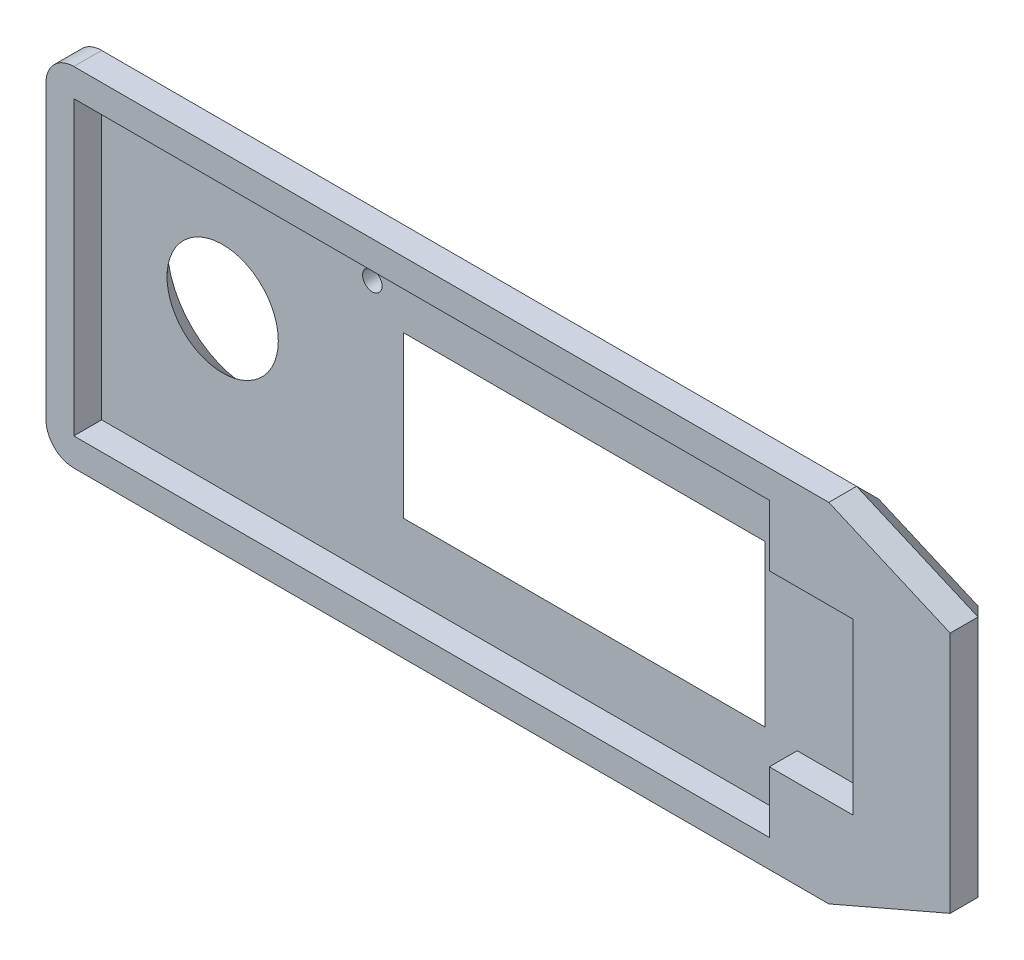
from build123d import *

# Parameters (mm, degrees)
EXTRUDE_1_DEPTH     = 2
EXTRUDE_2_DEPTH     = 2
SKETCH_4_R          = 4
SKETCH_4_R_2        = 0.7
SKETCH_4_W          = 26
SKETCH_4_H          = 11.55
CUT_EXTRUDE_1_DEPTH = 49.322997027
CHAMFER_3_SIZE      = 2
FILLET_2_R          = 2
CHAMFER_4_SIZE      = 2


# Some blends are built 0.0001 mm under size
with BuildPart() as part:
    # Эскиз1 → Бобышка-Вытянуть1 (new body)
    with BuildSketch(Plane.XY):
        Polygon((46.296875, 9.92578125), (37.5703125, 13.70078125), (-18.703125, 13.70078125), (-18.703125, -11.29921875), (37.5703125, -11.29921875), (46.296875, -7.52421875), align=None)
    extrude(amount=EXTRUDE_1_DEPTH)

    # Эскиз2 → Бобышка-Вытянуть2 (add)
    with BuildSketch(Plane.XY.offset(2)):
        Polygon((-18.703125, -11.29921875), (37.5703125, -11.29921875), (46.296875, -7.52421875), (46.296875, 9.92578125), (37.5703125, 13.70078125), (-18.703125, 13.70078125), align=None)
        Polygon((-16.703125, 11.70078125), (33.296875, 11.70078125), (33.296875, 7.30078125), (39.296875, 7.30078125), (39.296875, -4.89921875), (33.296875, -4.89921875), (33.296875, -9.29921875), (-16.703125, -9.29921875), align=None, mode=Mode.SUBTRACT)
    extrude(amount=EXTRUDE_2_DEPTH)

    # Эскиз4 → Вырез-Вытянуть1 (cut, through all)
    with BuildSketch(Plane.XY.offset(2)):
        with Locations((-8.003125, 1.96785345)):
            Circle(SKETCH_4_R)
        with Locations((2.756875, 9.10078125)):
            Circle(SKETCH_4_R_2)
        with Locations((17.996875, 1.20078125)):
            Rectangle(SKETCH_4_W, SKETCH_4_H)
    extrude(amount=-CUT_EXTRUDE_1_DEPTH, mode=Mode.SUBTRACT)

    # Фаска3
    # the kernel refuses this chamfer: 2 mm, written as the material it takes off along each edge
    with BuildSketch(Plane(origin=(51.017483297, 7.883706112, 0), x_dir=(0.010916712185249174, 0.025235859914990173, 0.9996219169112968), z_dir=(-0.9178052503070296, 0.3970308835705994, 0))) as chamfer_3_piece_1:
        Polygon((CHAMFER_3_SIZE * 0.999621916911, -CHAMFER_3_SIZE * 0.0274958766106), (-CHAMFER_3_SIZE * 0.0274958766106, -CHAMFER_3_SIZE * 0.999621916911), (0, 0), align=None)
    extrude(amount=19.794808417, mode=Mode.SUBTRACT)
    with BuildSketch(Plane(origin=(46.296875, -12.667584726, 0), x_dir=(0.02749587661058563, 0, 0.9996219169112968), z_dir=(0, 1, 0))) as chamfer_3_piece_2:
        Polygon((CHAMFER_3_SIZE * 0.999621916911, -CHAMFER_3_SIZE * 0.0274958766106), (-CHAMFER_3_SIZE * 0.0274958766106, -CHAMFER_3_SIZE * 0.999621916911), (0, 0), align=None)
    extrude(amount=27.736731952, mode=Mode.SUBTRACT)
    with BuildSketch(Plane(origin=(32.849704203, -13.341293888, 0), x_dir=(-0.3968807729078274, 0.9174582436631658, -0.027495876610586396), z_dir=(0.91780525030703, 0.3970308835705984, 0))) as chamfer_3_piece_3:
        Polygon((CHAMFER_3_SIZE * 0.999621916911, CHAMFER_3_SIZE * 0.0274958766106), (-CHAMFER_3_SIZE * 0.0274958766106, CHAMFER_3_SIZE * 0.999621916911), (0, 0), align=None)
    extrude(amount=19.794808417, mode=Mode.SUBTRACT)
    with BuildSketch(Plane(origin=(-8.003125, 1.96785345, 0), x_dir=(1, 0, 0), z_dir=(0, -1, 0))) as chamfer_3_piece_4:
        Polygon((4 + CHAMFER_3_SIZE, 0), (4, CHAMFER_3_SIZE), (4, 0), align=None)
    revolve(axis=Axis((-8.003125, 1.96785345, 0), (0, 0, 1)), mode=Mode.SUBTRACT)
    with BuildSketch(Plane(origin=(30.996875, 6.97578125, 0), x_dir=(0.9996219169112968, 0, -0.02749587661058632), z_dir=(0, -1, 0)), Plane(origin=(4.996875, -4.57421875, 0), x_dir=(-0.9996219169112968, 0, -0.027495876610586372), z_dir=(0, 1, 0))) as chamfer_3_piece_5:
        Polygon((CHAMFER_3_SIZE * 0.999621916911, CHAMFER_3_SIZE * 0.0274958766106), (-CHAMFER_3_SIZE * 0.0274958766106, CHAMFER_3_SIZE * 0.999621916911), (0, 0), align=None)
    extrude(amount=11.55, mode=Mode.SUBTRACT)
    with BuildSketch(Plane(origin=(30.996875, -4.57421875, 0), x_dir=(0, -0.9996219169112968, -0.027495876610586365), z_dir=(-1, 0, 0)), Plane(origin=(4.996875, 6.97578125, 0), x_dir=(0, 0.9996219169112968, -0.027495876610586348), z_dir=(1, 0, 0))) as chamfer_3_piece_6:
        Polygon((CHAMFER_3_SIZE * 0.999621916911, CHAMFER_3_SIZE * 0.0274958766106), (-CHAMFER_3_SIZE * 0.0274958766106, CHAMFER_3_SIZE * 0.999621916911), (0, 0), align=None)
    extrude(amount=26, mode=Mode.SUBTRACT)
    with BuildSketch(Plane(origin=(30.996875, 12.119147226, 0), x_dir=(0.9996219169112968, 0, -0.02749587661058632), z_dir=(0, -1, 0))) as chamfer_3_piece_7a_section:
        Polygon((CHAMFER_3_SIZE * 0.999621916911, CHAMFER_3_SIZE * 0.0274958766106), (-CHAMFER_3_SIZE * 0.0274958766106, CHAMFER_3_SIZE * 0.999621916911), (0, 0), align=None)
    chamfer_3_piece_7a = extrude(amount=16.693365976, mode=Mode.PRIVATE)
    chamfer_3_piece_7a = split(chamfer_3_piece_7a, bisect_by=Plane(origin=(31.656462254, 6.97578125, 0.659587254), z_dir=(0, 1, 0)), keep=Keep.TOP, mode=Mode.PRIVATE)
    with BuildSketch(Plane(origin=(4.996875, 6.97578125, 0), x_dir=(0, 0.9996219169112968, -0.027495876610586348), z_dir=(1, 0, 0))) as chamfer_3_piece_7b_section:
        Polygon((CHAMFER_3_SIZE * 0.999621916911, CHAMFER_3_SIZE * 0.0274958766106), (-CHAMFER_3_SIZE * 0.0274958766106, CHAMFER_3_SIZE * 0.999621916911), (0, 0), align=None)
    chamfer_3_piece_7b = extrude(amount=31.143365976, mode=Mode.PRIVATE)
    chamfer_3_piece_7b = split(chamfer_3_piece_7b, bisect_by=Plane(origin=(30.996875, 7.635368504, 0.659587254), z_dir=(1, 0, 0)), keep=Keep.TOP, mode=Mode.PRIVATE)
    chamfer_3_piece_7 = chamfer_3_piece_7a & chamfer_3_piece_7b
    add(chamfer_3_piece_7, mode=Mode.SUBTRACT)
    with BuildSketch(Plane(origin=(36.140240976, -4.57421875, 0), x_dir=(0, -0.9996219169112968, -0.027495876610586365), z_dir=(-1, 0, 0))) as chamfer_3_piece_8a_section:
        Polygon((CHAMFER_3_SIZE * 0.999621916911, CHAMFER_3_SIZE * 0.0274958766106), (-CHAMFER_3_SIZE * 0.0274958766106, CHAMFER_3_SIZE * 0.999621916911), (0, 0), align=None)
    chamfer_3_piece_8a = extrude(amount=31.143365976, mode=Mode.PRIVATE)
    chamfer_3_piece_8a = split(chamfer_3_piece_8a, bisect_by=Plane(origin=(30.996875, -5.233806004, 0.659587254), z_dir=(1, 0, 0)), keep=Keep.TOP, mode=Mode.PRIVATE)
    with BuildSketch(Plane(origin=(30.996875, 6.97578125, 0), x_dir=(0.9996219169112968, 0, -0.02749587661058632), z_dir=(0, -1, 0))) as chamfer_3_piece_8b_section:
        Polygon((CHAMFER_3_SIZE * 0.999621916911, CHAMFER_3_SIZE * 0.0274958766106), (-CHAMFER_3_SIZE * 0.0274958766106, CHAMFER_3_SIZE * 0.999621916911), (0, 0), align=None)
    chamfer_3_piece_8b = extrude(amount=16.693365976, mode=Mode.PRIVATE)
    chamfer_3_piece_8b = split(chamfer_3_piece_8b, bisect_by=Plane(origin=(31.656462254, -4.57421875, 0.659587254), z_dir=(0, -1, 0)), keep=Keep.TOP, mode=Mode.PRIVATE)
    chamfer_3_piece_8 = chamfer_3_piece_8a & chamfer_3_piece_8b
    add(chamfer_3_piece_8, mode=Mode.SUBTRACT)
    with BuildSketch(Plane(origin=(4.996875, -9.717584726, 0), x_dir=(-0.9996219169112968, 0, -0.027495876610586355), z_dir=(0, 1, 0))) as chamfer_3_piece_9a_section:
        Polygon((CHAMFER_3_SIZE * 0.999621916911, CHAMFER_3_SIZE * 0.0274958766106), (-CHAMFER_3_SIZE * 0.0274958766106, CHAMFER_3_SIZE * 0.999621916911), (0, 0), align=None)
    chamfer_3_piece_9a = extrude(amount=16.693365976, mode=Mode.PRIVATE)
    chamfer_3_piece_9a = split(chamfer_3_piece_9a, bisect_by=Plane(origin=(4.337287746, -4.57421875, 0.659587254), z_dir=(0, -1, 0)), keep=Keep.TOP, mode=Mode.PRIVATE)
    with BuildSketch(Plane(origin=(30.996875, -4.57421875, 0), x_dir=(0, -0.9996219169112968, -0.027495876610586365), z_dir=(-1, 0, 0))) as chamfer_3_piece_9b_section:
        Polygon((CHAMFER_3_SIZE * 0.999621916911, CHAMFER_3_SIZE * 0.0274958766106), (-CHAMFER_3_SIZE * 0.0274958766106, CHAMFER_3_SIZE * 0.999621916911), (0, 0), align=None)
    chamfer_3_piece_9b = extrude(amount=31.143365976, mode=Mode.PRIVATE)
    chamfer_3_piece_9b = split(chamfer_3_piece_9b, bisect_by=Plane(origin=(4.996875, -5.233806004, 0.659587254), z_dir=(-1, 0, 0)), keep=Keep.TOP, mode=Mode.PRIVATE)
    chamfer_3_piece_9 = chamfer_3_piece_9a & chamfer_3_piece_9b
    add(chamfer_3_piece_9, mode=Mode.SUBTRACT)
    with BuildSketch(Plane(origin=(4.996875, -4.57421875, 0), x_dir=(-0.9996219169112968, 0, -0.027495876610586372), z_dir=(0, 1, 0))) as chamfer_3_piece_10a_section:
        Polygon((CHAMFER_3_SIZE * 0.999621916911, CHAMFER_3_SIZE * 0.0274958766106), (-CHAMFER_3_SIZE * 0.0274958766106, CHAMFER_3_SIZE * 0.999621916911), (0, 0), align=None)
    chamfer_3_piece_10a = extrude(amount=16.693365976, mode=Mode.PRIVATE)
    chamfer_3_piece_10a = split(chamfer_3_piece_10a, bisect_by=Plane(origin=(4.337287746, 6.97578125, 0.659587254), z_dir=(0, 1, 0)), keep=Keep.TOP, mode=Mode.PRIVATE)
    with BuildSketch(Plane(origin=(-0.146490976, 6.97578125, 0), x_dir=(0, 0.9996219169112968, -0.027495876610586348), z_dir=(1, 0, 0))) as chamfer_3_piece_10b_section:
        Polygon((CHAMFER_3_SIZE * 0.999621916911, CHAMFER_3_SIZE * 0.0274958766106), (-CHAMFER_3_SIZE * 0.0274958766106, CHAMFER_3_SIZE * 0.999621916911), (0, 0), align=None)
    chamfer_3_piece_10b = extrude(amount=31.143365976, mode=Mode.PRIVATE)
    chamfer_3_piece_10b = split(chamfer_3_piece_10b, bisect_by=Plane(origin=(4.996875, 7.635368504, 0.659587254), z_dir=(-1, 0, 0)), keep=Keep.TOP, mode=Mode.PRIVATE)
    chamfer_3_piece_10 = chamfer_3_piece_10a & chamfer_3_piece_10b
    add(chamfer_3_piece_10, mode=Mode.SUBTRACT)

    # Скругление2
    fillet_2_edges = [part.edges().sort_by_distance(p)[0] for p in [
        (-18.703125, 13.70078125, 2),
        (-18.703125, -11.29921875, 2),
    ]]
    fillet(fillet_2_edges, radius=FILLET_2_R)

    # Фаска4
    chamfer_4_edges = [part.edges().sort_by_distance(p)[0] for p in [
        (7.914897998, -11.29921875, 0),
        (-18.117338562, -10.713432312, 0),
        (-18.703125, 1.20078125, 0),
        (-18.117338562, 13.114994812, 0),
        (7.914897998, 13.70078125, 0),
    ]]
    chamfer(chamfer_4_edges, length=CHAMFER_4_SIZE - 0.0001)  # a hair under: the kernel refuses the full size


solid = part.part
